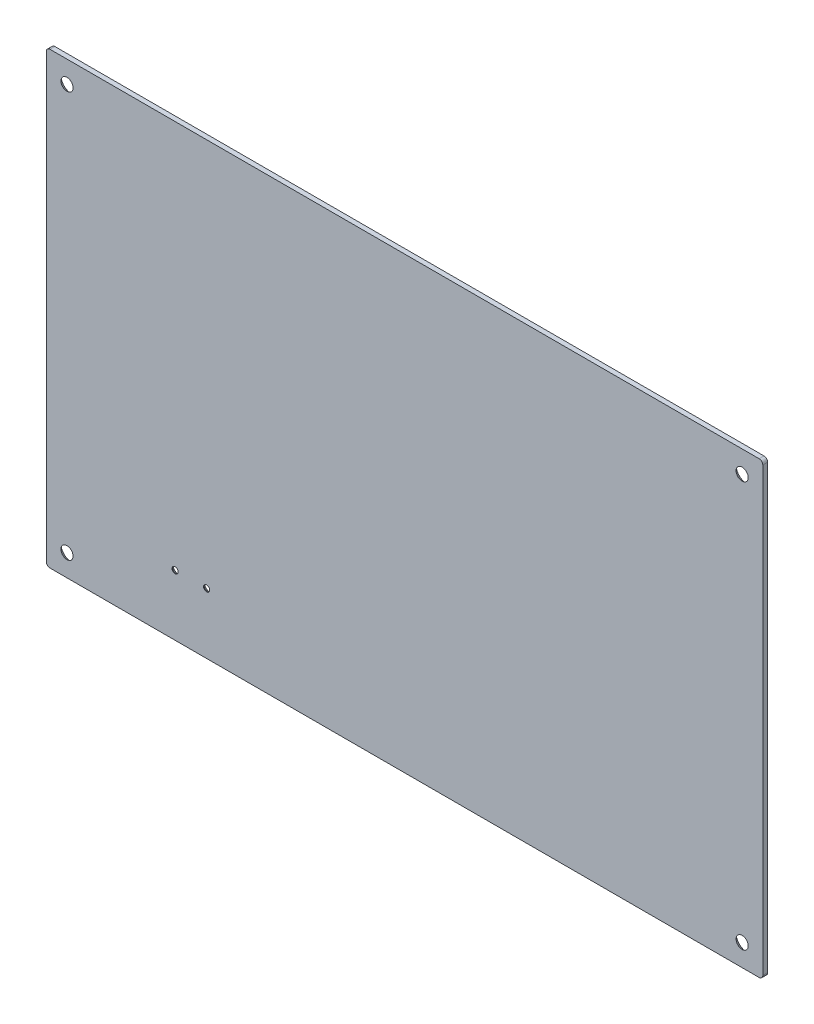
from build123d import *

# Parameters (mm, degrees)
BASE_FLANGE1_DEPTH             = 2
FURO_ROSCADO_DE_M31_AT_2_COUNT = 2
FURO_ROSCADO_DE_M31_AT_2_PITCH = 13


# Sheet-metal steps are written as plain solids
with BuildPart() as part:
    # Sketch1 → Base-Flange1 (new body)
    with BuildSketch(Plane.XY):
        with BuildLine():
            Line((-146, 92.5), (146, 92.5))
            ThreePointArc((146, 92.5), (147.060660172, 92.060660172), (147.5, 91))
            Line((147.5, 91), (147.5, -91))
            ThreePointArc((147.5, -91), (147.060660172, -92.060660172), (146, -92.5))
            Line((146, -92.5), (-146, -92.5))
            ThreePointArc((-146, -92.5), (-147.060660172, -92.060660172), (-147.5, -91))
            Line((-147.5, -91), (-147.5, 91))
            ThreePointArc((-147.5, 91), (-147.060660172, 92.060660172), (-146, 92.5))
        make_face()
    extrude(amount=BASE_FLANGE1_DEPTH)

    # Esboço3 → Furo roscado de M41 (revolve, cut)
    with BuildSketch(Plane(origin=(-139, 83.5, 2), x_dir=(0, -1, 0), z_dir=(1, 0, 0))):
        Polygon((0, 0), (0, 2), (4.5, 2), (1.65, -0.85), (1.65, 0), align=None)
    furo_roscado_de_m41 = revolve(axis=Axis((-139, 83.5, 8.35), (0, 0, -1)), mode=Mode.SUBTRACT)

    # Espelhar1: Furo roscado de M41 across plane
    add(furo_roscado_de_m41.mirror(Plane.ZX), mode=Mode.SUBTRACT)

    # Espelhar2: Furo roscado de M41 across plane
    add(furo_roscado_de_m41.mirror(Plane(origin=(0, 0, 0), x_dir=(0, 0, 1), z_dir=(1, 0, 0))), mode=Mode.SUBTRACT)

    # Espelhar2 copy 1 sketch → Espelhar2 copy 1 (revolve, cut)
    with BuildSketch(Plane(origin=(139, -83.5, 2), x_dir=(0, 1, 0), z_dir=(-1, 0, 0))):
        Polygon((0, 0), (0, 2), (4.5, 2), (1.65, -0.85), (1.65, 0), align=None)
    revolve(axis=Axis((139, -83.5, 8.35), (0, 0, -1)), mode=Mode.SUBTRACT)

    # Esboço5 → Furo roscado de M31 (revolve, cut)
    with BuildSketch(Plane(origin=(-94.5, -67.5, 2), x_dir=(0, -1, 0), z_dir=(1, 0, 0))):
        Polygon((0, 0), (0, 2), (3, 2), (1.25, 0.25), (1.25, 0), align=None)
    furo_roscado_de_m31 = revolve(axis=Axis((-94.5, -67.5, 8.35), (0, 0, -1)), mode=Mode.SUBTRACT)

    # Furo roscado de M31 at 2: Furo roscado de M31 ×2
    with Locations(*[(i * FURO_ROSCADO_DE_M31_AT_2_PITCH, 0, 0) for i in range(1, FURO_ROSCADO_DE_M31_AT_2_COUNT)]):
        add(furo_roscado_de_m31, mode=Mode.SUBTRACT)


solid = part.part
